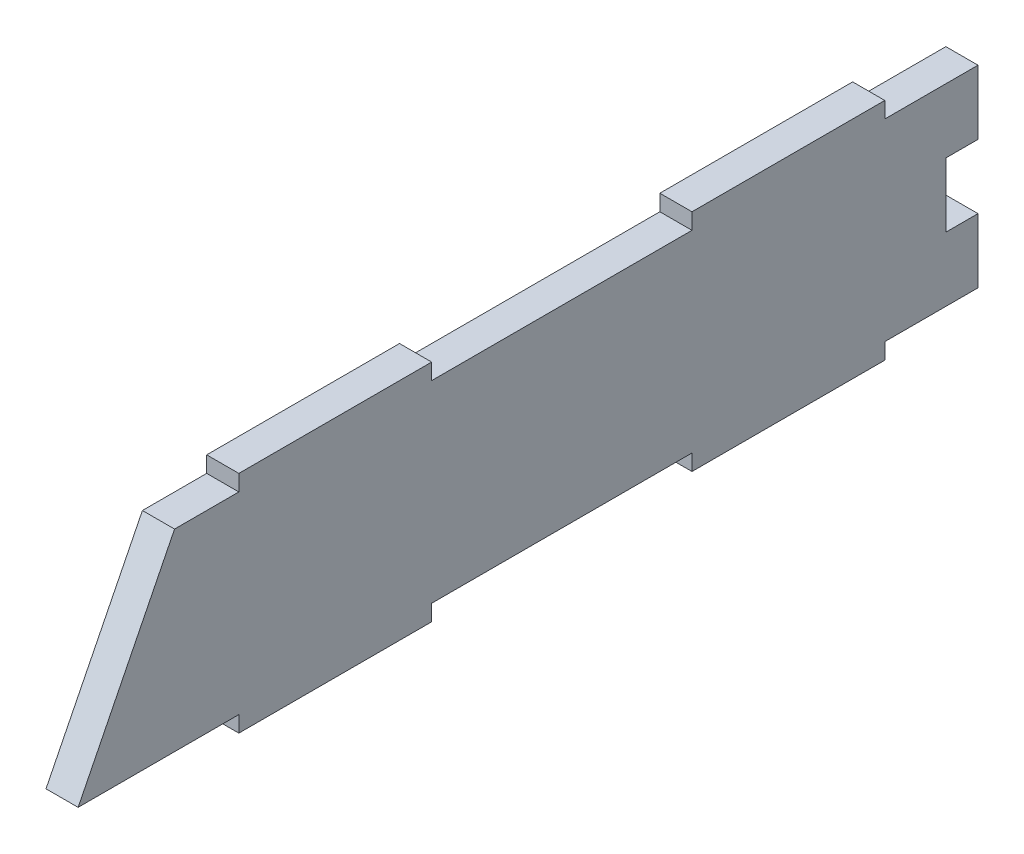
from build123d import *

# Parameters (mm, degrees)
SKETCH1_W               = 355.6
SKETCH1_H               = 76.2
BOSS_EXTRUDE1_DEPTH     = 12.7
CUT_EXTRUDE1_DEPTH      = 183.279291199
CUT_EXTRUDE1_DEPTH_BACK = 183.279291199
SKETCH3_W               = 76.2
SKETCH3_H               = 6.35
BOSS_EXTRUDE2_DEPTH     = 12.7
SKETCH4_W               = 12.7
SKETCH4_H               = 25.4
CUT_EXTRUDE2_DEPTH      = 184.711546997


with BuildPart() as part:
    # Sketch1 → Boss-Extrude1 (new body)
    with BuildSketch(Plane(origin=(0, 0, 0), x_dir=(0, 0, -1), z_dir=(1, 0, 0))):
        Rectangle(SKETCH1_W, SKETCH1_H)
    extrude(amount=BOSS_EXTRUDE1_DEPTH)

    # Sketch2 → Cut-Extrude1 (cut, two sides: drawn at the far end of the back side and taken through both)
    with BuildSketch(Plane(origin=(12.7, 0, 0), x_dir=(0, 0, -1), z_dir=(1, 0, 0)).offset(-CUT_EXTRUDE1_DEPTH_BACK)):
        Polygon((-507.550847217, -697.601694433), (-177.8, -38.1), (-139.7, 38.1), (190.050847217, 697.601694433), (-1128.95254165, 1357.103388866), (-1826.554236083, -38.1), align=None)
    extrude(amount=CUT_EXTRUDE1_DEPTH + CUT_EXTRUDE1_DEPTH_BACK, mode=Mode.SUBTRACT)

    # Sketch3 → Boss-Extrude2 (add)
    with BuildSketch(Plane.ZY):
        with Locations((-102.87, -41.275)):
            Rectangle(SKETCH3_W, SKETCH3_H)
        with Locations((76.2, -41.275)):
            Rectangle(SKETCH3_W, SKETCH3_H)
        with Locations((-102.87, 41.275)):
            Rectangle(SKETCH3_W, SKETCH3_H)
        with Locations((76.2, 41.275)):
            Rectangle(SKETCH3_W, SKETCH3_H)
    extrude(amount=-BOSS_EXTRUDE2_DEPTH)

    # Sketch4 → Cut-Extrude2 (cut, through all)
    with BuildSketch(Plane.ZY):
        with Locations((-171.45, 0)):
            Rectangle(SKETCH4_W, SKETCH4_H)
    extrude(amount=-CUT_EXTRUDE2_DEPTH, mode=Mode.SUBTRACT)


solid = part.part
